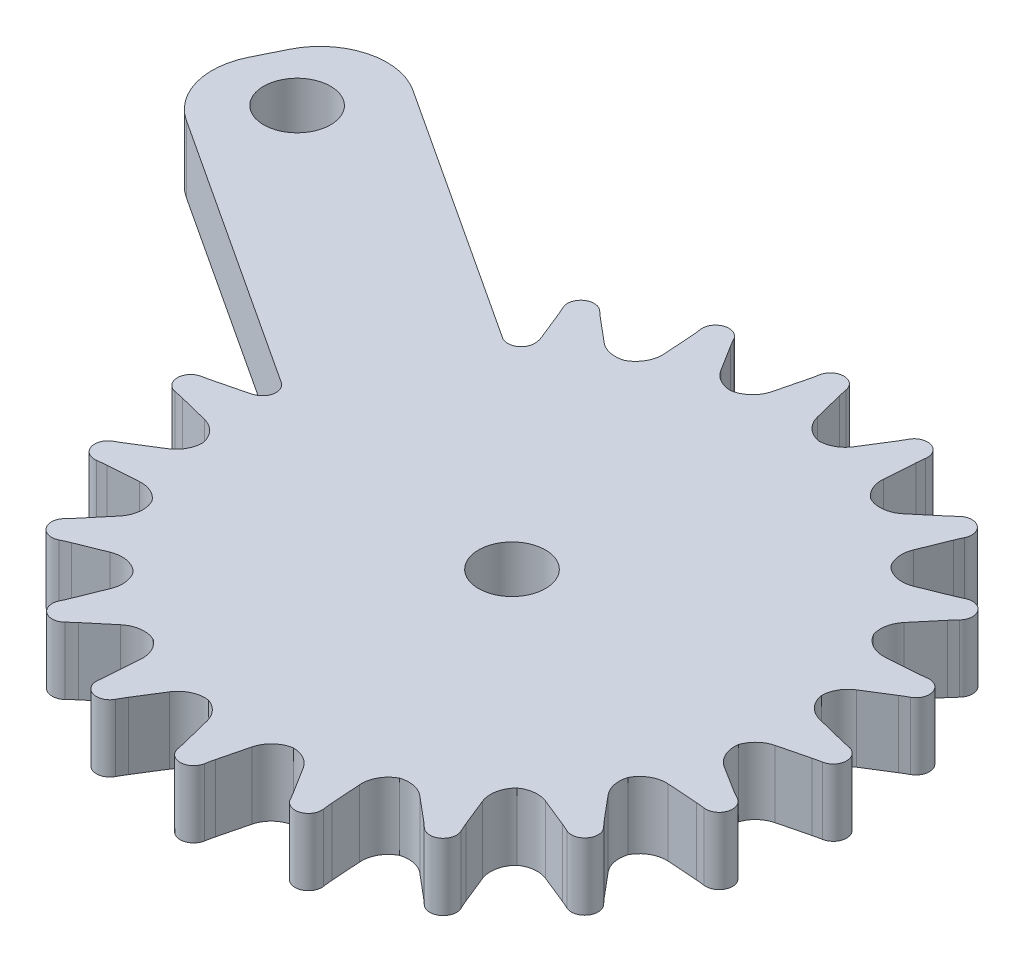
from build123d import *

# Parameters (mm, degrees)
SKETCH1_R           = 20
BOSS_EXTRUDE1_DEPTH = 5
BOSS_EXTRUDE2_START = -5
BOSS_EXTRUDE2_DEPTH = 5
FILLET1_R           = 2
CIRPATTERN1_DEPTH   = 5
SKETCH4_R           = 2.5
BOSS_EXTRUDE3_DEPTH = 5
FILLET2_R           = 5
SKETCH3_R           = 2.5
CUT_EXTRUDE1_DEPTH  = 10
SKETCH5_R           = 5
SKETCH5_R_2         = 2.5
BOSS_EXTRUDE4_DEPTH = 5
FILLET3_R           = 2
FILLET4_R           = 1


# Read off the part's stored shape, not the designer's step: CirPattern1
with BuildPart() as part:
    # Sketch1 → Boss-Extrude1 (new body)
    with BuildSketch(Plane(origin=(0, 0, 0), x_dir=(1, 0, 0), z_dir=(0, 1, 0))):
        with Locations(Location((0, 0, 0), (0, 0, 270))):
            Circle(SKETCH1_R)
    extrude(amount=BOSS_EXTRUDE1_DEPTH)

    # Sketch2 → Boss-Extrude2 (add)
    with BuildSketch(Plane(origin=(0, 5, 0), x_dir=(1, 0, 0), z_dir=(0, 1, 0)).offset(BOSS_EXTRUDE2_START)):
        with BuildLine():
            Line((-2.105791814, 19.888832063), (-1.238592318, 23.357630049))
            ThreePointArc((-1.238592318, 23.357630049), (-1.158488111, 23.704119695), (-1.090754777, 24.053238521))
            ThreePointArc((-1.090754777, 24.053238521), (-0.109023339, 24.880258639), (0.877972386, 24.059528275))
            ThreePointArc((0.877972386, 24.059528275), (0.941143779, 23.742067411), (1.014556469, 23.426817347))
            Line((1.014556469, 23.426817347), (1.893724984, 19.910143286))
            ThreePointArc((1.893724984, 19.910143286), (-0.106567477, 19.999716082), (-2.105791814, 19.888832063))
        make_face()
    extrude(amount=BOSS_EXTRUDE2_DEPTH)

    # Fillet1
    fillet1_edges = [part.edges().sort_by_distance(p)[0] for p in [
        (1.893724984, 2.5, -19.910143286),
        (-2.105791814, 2.5, -19.888832063),
    ]]
    fillet(fillet1_edges, radius=FILLET1_R)

    # CirPattern1 outline → CirPattern1 (add)
    with BuildSketch(Plane(origin=(0, 0, 0), x_dir=(1, 0, 0), z_dir=(0, 1, 0))):
        with BuildLine():
            ThreePointArc((-18.818349161, -15.020578024), (-18.496093443, -14.870168545), (-18.16869336, -14.731312705))
            Line((-18.16869336, -14.731312705), (-16.10451314, -13.898848252))
            ThreePointArc((-16.10451314, -13.898848252), (-14.969635701, -13.791456908), (-13.960430105, -14.321535926))
            ThreePointArc((-13.960430105, -14.321535926), (-16.121714854, -11.835975249), (-17.845731798, -9.029388491))
            ThreePointArc((-17.845731798, -9.029388491), (-17.643410931, -10.160914391), (-18.097403186, -11.216933153))
            Line((-18.097403186, -11.216933153), (-19.549034688, -12.94914432))
            ThreePointArc((-19.549034688, -12.94914432), (-19.760926451, -13.193835771), (-19.980626471, -13.431541317))
            ThreePointArc((-19.980626471, -13.431541317), (-20.064469753, -14.712450836), (-18.818349161, -15.020578024))
        make_face()
        with BuildLine():
            ThreePointArc((-8.242021953, 19.611282475), (-8.490583131, 18.498764143), (-9.306579914, 17.702756009))
            ThreePointArc((-9.306579914, 17.702756009), (-6.422679306, 18.940675556), (-3.380631018, 19.712212811))
            ThreePointArc((-3.380631018, 19.712212811), (-4.340011374, 19.966775936), (-5.058856916, 20.651227642))
            Line((-5.058856916, 20.651227642), (-6.274384144, 22.593742485))
            ThreePointArc((-6.274384144, 22.593742485), (-6.441621387, 22.870877344), (-6.599801755, 23.153279533))
            ThreePointArc((-6.599801755, 23.153279533), (-7.792110102, 23.628842042), (-8.470228911, 22.53892747))
            ThreePointArc((-8.470228911, 22.53892747), (-8.42676349, 22.185964985), (-8.395875928, 21.831680188))
            Line((-8.395875928, 21.831680188), (-8.242021953, 19.611282475))
        make_face()
        with BuildLine():
            ThreePointArc((-13.898848252, 16.10451314), (-13.791456908, 14.969635701), (-14.321535926, 13.960430105))
            ThreePointArc((-14.321535926, 13.960430105), (-11.961321637, 16.028935855), (-9.306579913, 17.702756008))
            ThreePointArc((-9.306579913, 17.702756008), (-10.297669185, 17.648395093), (-11.192839131, 18.077211859))
            Line((-11.192839131, 18.077211859), (-12.94914432, 19.549034688))
            ThreePointArc((-12.94914432, 19.549034688), (-13.193835771, 19.760926451), (-13.431541317, 19.980626471))
            ThreePointArc((-13.431541317, 19.980626471), (-14.712450836, 20.064469753), (-15.020578024, 18.818349161))
            ThreePointArc((-15.020578024, 18.818349161), (-14.870168545, 18.496093443), (-14.731312705, 18.16869336))
            Line((-14.731312705, 18.16869336), (-13.898848252, 16.10451314))
        make_face()
        with BuildLine():
            ThreePointArc((-18.195158445, 11.021321851), (-17.742326793, 9.975175019), (-17.934600217, 8.851560036))
            ThreePointArc((-17.934600217, 8.851560036), (-16.329106467, 11.548172233), (-14.321535925, 13.960430104))
            ThreePointArc((-14.321535925, 13.960430104), (-15.247319388, 13.602466375), (-16.231188267, 13.733672628))
            Line((-16.231188267, 13.733672628), (-18.356352028, 14.59073117))
            ThreePointArc((-18.356352028, 14.59073117), (-18.654545583, 14.716638395), (-18.948508031, 14.852130478))
            ThreePointArc((-18.948508031, 14.852130478), (-20.192634375, 14.536047367), (-20.100608305, 13.255699721))
            ThreePointArc((-20.100608305, 13.255699721), (-19.857977897, 12.995695406), (-19.624745956, 12.727228237))
            Line((-19.624745956, 12.727228237), (-18.195158445, 11.021321851))
        make_face()
        with BuildLine():
            ThreePointArc((-20.710399757, 4.85928679), (-19.956454114, 4.004274704), (-19.792100881, 2.876237597))
            ThreePointArc((-19.792100881, 2.876237597), (-19.098484585, 5.936993052), (-17.934600215, 8.851560035))
            ThreePointArc((-17.934600215, 8.851560035), (-18.704455735, 8.225033474), (-19.680715605, 8.045785833))
            Line((-19.680715605, 8.045785833), (-21.966712103, 8.204185225))
            ThreePointArc((-21.966712103, 8.204185225), (-22.289218499, 8.231783236), (-22.610662757, 8.269804472))
            ThreePointArc((-22.610662757, 8.269804472), (-23.696222171, 7.584735387), (-23.213050996, 6.395490034))
            ThreePointArc((-23.213050996, 6.395490034), (-22.901950013, 6.223188155), (-22.597172338, 6.039933339))
            Line((-22.597172338, 6.039933339), (-20.710399757, 4.85928679))
        make_face()
        with BuildLine():
            ThreePointArc((-21.198362842, -1.778409119), (-20.217104661, -2.358591919), (-19.712212811, -3.380631018))
            ThreePointArc((-19.712212811, -3.380631018), (-19.998369964, -0.255340374), (-19.792100879, 2.876237597))
            ThreePointArc((-19.792100879, 2.876237597), (-20.330669633, 2.042476989), (-21.203757377, 1.570321461))
            Line((-21.203757377, 1.570321461), (-23.426817347, 1.014556469))
            ThreePointArc((-23.426817347, 1.014556469), (-23.74206741, 0.941143779), (-24.059528275, 0.877972386))
            ThreePointArc((-24.059528275, 0.877972386), (-24.880258639, -0.109023339), (-24.053238521, -1.090754777))
            ThreePointArc((-24.053238521, -1.090754777), (-23.704119695, -1.158488111), (-23.357630049, -1.238592318))
            Line((-23.357630049, -1.238592318), (-21.198362842, -1.778409119))
        make_face()
        with BuildLine():
            ThreePointArc((-19.579720151, -8.239834962), (-18.612665626, -8.414862877), (-17.845731799, -9.029388492))
            ThreePointArc((-17.845731799, -9.029388492), (-18.990179463, -6.274797518), (-19.71221281, -3.380631018))
            ThreePointArc((-19.71221281, -3.380631018), (-19.966775936, -4.340011374), (-20.651227642, -5.058856916))
            Line((-20.651227642, -5.058856916), (-22.593742485, -6.274384144))
            ThreePointArc((-22.593742485, -6.274384144), (-22.870877344, -6.441621387), (-23.153279533, -6.599801755))
            ThreePointArc((-23.153279533, -6.599801755), (-23.628842042, -7.792110102), (-22.53892747, -8.470228911))
            ThreePointArc((-22.53892747, -8.470228911), (-22.185964985, -8.42676349), (-21.831680188, -8.395875928))
            Line((-21.831680188, -8.395875928), (-19.579720151, -8.239834962))
        make_face()
        with BuildLine():
            ThreePointArc((3.184529229, 19.744841696), (6.085729599, 19.051611356), (8.851560036, 17.934600217))
            ThreePointArc((8.851560036, 17.934600217), (8.225033474, 18.704455735), (8.045785833, 19.680715605))
            Line((8.045785833, 19.680715605), (8.204185225, 21.966712103))
            ThreePointArc((8.204185225, 21.966712103), (8.231783236, 22.289218499), (8.269804472, 22.610662757))
            ThreePointArc((8.269804472, 22.610662757), (7.584735387, 23.696222171), (6.395490034, 23.213050996))
            ThreePointArc((6.395490034, 23.213050996), (6.223188155, 22.901950013), (6.039933339, 22.597172338))
            Line((6.039933339, 22.597172338), (4.842504233, 20.683579819))
            ThreePointArc((4.842504233, 20.683579819), (4.132483288, 20.004095101), (3.184529229, 19.744841696))
        make_face()
        with BuildLine():
            ThreePointArc((8.851560036, 17.934600217), (11.548172234, 16.329106469), (13.960430106, 14.321535927))
            ThreePointArc((13.960430106, 14.321535927), (13.602466375, 15.247319388), (13.733672628, 16.231188267))
            Line((13.733672628, 16.231188267), (14.59073117, 18.356352028))
            ThreePointArc((14.59073117, 18.356352028), (14.716638395, 18.654545583), (14.852130478, 18.948508031))
            ThreePointArc((14.852130478, 18.948508031), (14.536047367, 20.192634375), (13.255699721, 20.100608305))
            ThreePointArc((13.255699721, 20.100608305), (12.995695406, 19.857977897), (12.727228237, 19.624745956))
            Line((12.727228237, 19.624745956), (11.021321851, 18.195158445))
            ThreePointArc((11.021321851, 18.195158445), (9.975175019, 17.742326793), (8.851560036, 17.934600217))
        make_face()
        with BuildLine():
            ThreePointArc((13.960430106, 14.321535927), (16.028935857, 11.961321639), (17.70275601, 9.306579915))
            ThreePointArc((17.70275601, 9.306579915), (17.648395093, 10.297669185), (18.077211859, 11.192839131))
            Line((18.077211859, 11.192839131), (19.549034688, 12.94914432))
            ThreePointArc((19.549034688, 12.94914432), (19.760926451, 13.193835771), (19.980626471, 13.431541317))
            ThreePointArc((19.980626471, 13.431541317), (20.064469753, 14.712450836), (18.818349161, 15.020578024))
            ThreePointArc((18.818349161, 15.020578024), (18.496093443, 14.870168545), (18.16869336, 14.731312705))
            Line((18.16869336, 14.731312705), (16.10451314, 13.898848252))
            ThreePointArc((16.10451314, 13.898848252), (14.969635701, 13.791456908), (13.960430106, 14.321535927))
        make_face()
        with BuildLine():
            ThreePointArc((17.70275601, 9.306579915), (18.940675558, 6.422679307), (19.712212813, 3.380631018))
            ThreePointArc((19.712212813, 3.380631018), (19.966775936, 4.340011374), (20.651227642, 5.058856916))
            Line((20.651227642, 5.058856916), (22.593742485, 6.274384144))
            ThreePointArc((22.593742485, 6.274384144), (22.870877344, 6.441621387), (23.153279533, 6.599801755))
            ThreePointArc((23.153279533, 6.599801755), (23.628842042, 7.792110102), (22.53892747, 8.470228911))
            ThreePointArc((22.53892747, 8.470228911), (22.185964985, 8.42676349), (21.831680188, 8.395875928))
            Line((21.831680188, 8.395875928), (19.611282475, 8.242021953))
            ThreePointArc((19.611282475, 8.242021953), (18.498764143, 8.490583131), (17.70275601, 9.306579915))
        make_face()
        with BuildLine():
            ThreePointArc((19.712212813, 3.380631018), (19.998369968, 0.255340374), (19.792100883, -2.876237597))
            ThreePointArc((19.792100883, -2.876237597), (20.330669633, -2.042476989), (21.203757377, -1.570321461))
            Line((21.203757377, -1.570321461), (23.426817347, -1.014556469))
            ThreePointArc((23.426817347, -1.014556469), (23.74206741, -0.941143779), (24.059528275, -0.877972386))
            ThreePointArc((24.059528275, -0.877972386), (24.880258639, 0.109023339), (24.053238521, 1.090754777))
            ThreePointArc((24.053238521, 1.090754777), (23.704119695, 1.158488111), (23.357630049, 1.238592318))
            Line((23.357630049, 1.238592318), (21.198362842, 1.778409119))
            ThreePointArc((21.198362842, 1.778409119), (20.217104661, 2.358591919), (19.712212813, 3.380631018))
        make_face()
        with BuildLine():
            ThreePointArc((19.792100883, -2.876237597), (19.051611357, -6.085729599), (17.794386708, -9.130158911))
            ThreePointArc((17.794386708, -9.130158911), (18.590889166, -8.301383653), (19.712076244, -8.047958848))
            Line((19.712076244, -8.047958848), (21.966712103, -8.204185225))
            ThreePointArc((21.966712103, -8.204185225), (22.289218499, -8.231783236), (22.610662757, -8.269804472))
            ThreePointArc((22.610662757, -8.269804472), (23.696222171, -7.584735387), (23.213050996, -6.395490034))
            ThreePointArc((23.213050996, -6.395490034), (22.901950013, -6.223188155), (22.597172338, -6.039933339))
            Line((22.597172338, -6.039933339), (20.710399757, -4.85928679))
            ThreePointArc((20.710399757, -4.85928679), (19.956454114, -4.004274704), (19.792100883, -2.876237597))
        make_face()
        with BuildLine():
            ThreePointArc((17.794386708, -9.130158911), (16.238565258, -11.675144471), (14.321535927, -13.960430106))
            ThreePointArc((14.321535927, -13.960430106), (15.247319388, -13.602466375), (16.231188267, -13.733672628))
            Line((16.231188267, -13.733672628), (18.356352028, -14.59073117))
            ThreePointArc((18.356352028, -14.59073117), (18.654545583, -14.716638395), (18.948508031, -14.852130478))
            ThreePointArc((18.948508031, -14.852130478), (20.192634375, -14.536047367), (20.100608305, -13.255699721))
            ThreePointArc((20.100608305, -13.255699721), (19.857977897, -12.995695406), (19.624745956, -12.727228237))
            Line((19.624745956, -12.727228237), (18.174837264, -10.997072875))
            ThreePointArc((18.174837264, -10.997072875), (17.748017433, -10.111830503), (17.794386708, -9.130158911))
        make_face()
        with BuildLine():
            ThreePointArc((14.321535927, -13.960430106), (11.961321639, -16.028935857), (9.306579914, -17.70275601))
            ThreePointArc((9.306579914, -17.70275601), (10.297669185, -17.648395093), (11.192839131, -18.077211859))
            Line((11.192839131, -18.077211859), (12.94914432, -19.549034688))
            ThreePointArc((12.94914432, -19.549034688), (13.193835771, -19.760926451), (13.431541317, -19.980626471))
            ThreePointArc((13.431541317, -19.980626471), (14.712450836, -20.064469753), (15.020578024, -18.818349161))
            ThreePointArc((15.020578024, -18.818349161), (14.870168545, -18.496093443), (14.731312705, -18.16869336))
            Line((14.731312705, -18.16869336), (13.898848252, -16.10451314))
            ThreePointArc((13.898848252, -16.10451314), (13.791456908, -14.969635701), (14.321535927, -13.960430106))
        make_face()
        with BuildLine():
            ThreePointArc((9.306579914, -17.70275601), (6.422679306, -18.940675557), (3.380631018, -19.712212812))
            ThreePointArc((3.380631018, -19.712212812), (4.340011374, -19.966775936), (5.058856916, -20.651227642))
            Line((5.058856916, -20.651227642), (6.274384144, -22.593742485))
            ThreePointArc((6.274384144, -22.593742485), (6.441621387, -22.870877344), (6.599801755, -23.153279533))
            ThreePointArc((6.599801755, -23.153279533), (7.792110102, -23.628842042), (8.470228911, -22.53892747))
            ThreePointArc((8.470228911, -22.53892747), (8.42676349, -22.185964985), (8.395875928, -21.831680188))
            Line((8.395875928, -21.831680188), (8.242021953, -19.611282475))
            ThreePointArc((8.242021953, -19.611282475), (8.490583131, -18.498764143), (9.306579914, -17.70275601))
        make_face()
        with BuildLine():
            ThreePointArc((3.380631018, -19.712212812), (0.255340374, -19.998369966), (-2.876237597, -19.792100881))
            ThreePointArc((-2.876237597, -19.792100881), (-2.042476989, -20.330669633), (-1.570321461, -21.203757377))
            Line((-1.570321461, -21.203757377), (-1.014556469, -23.426817347))
            ThreePointArc((-1.014556469, -23.426817347), (-0.941143779, -23.74206741), (-0.877972386, -24.059528275))
            ThreePointArc((-0.877972386, -24.059528275), (0.109023339, -24.880258639), (1.090754777, -24.053238521))
            ThreePointArc((1.090754777, -24.053238521), (1.158488111, -23.704119695), (1.238592318, -23.357630049))
            Line((1.238592318, -23.357630049), (1.778409119, -21.198362842))
            ThreePointArc((1.778409119, -21.198362842), (2.358591919, -20.217104661), (3.380631018, -19.712212812))
        make_face()
        with BuildLine():
            ThreePointArc((-2.876237597, -19.792100881), (-5.936993053, -19.098484586), (-8.851560035, -17.934600216))
            ThreePointArc((-8.851560035, -17.934600216), (-8.225033474, -18.704455735), (-8.045785833, -19.680715605))
            Line((-8.045785833, -19.680715605), (-8.204185225, -21.966712103))
            ThreePointArc((-8.204185225, -21.966712103), (-8.231783236, -22.289218499), (-8.269804472, -22.610662757))
            ThreePointArc((-8.269804472, -22.610662757), (-7.584735387, -23.696222171), (-6.395490034, -23.213050996))
            ThreePointArc((-6.395490034, -23.213050996), (-6.223188155, -22.901950013), (-6.039933339, -22.597172338))
            Line((-6.039933339, -22.597172338), (-4.85928679, -20.710399757))
            ThreePointArc((-4.85928679, -20.710399757), (-4.004274704, -19.956454114), (-2.876237597, -19.792100881))
        make_face()
        with BuildLine():
            ThreePointArc((-8.851560035, -17.934600216), (-11.548172233, -16.329106468), (-13.960430104, -14.321535925))
            ThreePointArc((-13.960430104, -14.321535925), (-13.602466375, -15.247319388), (-13.733672628, -16.231188267))
            Line((-13.733672628, -16.231188267), (-14.59073117, -18.356352028))
            ThreePointArc((-14.59073117, -18.356352028), (-14.716638395, -18.654545583), (-14.852130478, -18.948508031))
            ThreePointArc((-14.852130478, -18.948508031), (-14.536047367, -20.192634375), (-13.255699721, -20.100608305))
            ThreePointArc((-13.255699721, -20.100608305), (-12.995695406, -19.857977897), (-12.727228237, -19.624745956))
            Line((-12.727228237, -19.624745956), (-11.021321851, -18.195158445))
            ThreePointArc((-11.021321851, -18.195158445), (-9.975175019, -17.742326793), (-8.851560035, -17.934600216))
        make_face()
    extrude(amount=CIRPATTERN1_DEPTH)

    # Sketch4 → Boss-Extrude3 (add)
    with BuildSketch(Plane.XZ):
        Polygon((-19.792100881, -2.876237597), (-44.897063424, -19.30002692), (-39.426498468, -30.384219429), (-14.321535926, -13.960430105), align=None)
        with Locations(Location((-38.007180457, -21.962528948, 0), (0, 0, 270))):
            Circle(SKETCH4_R, mode=Mode.SUBTRACT)
    extrude(amount=-BOSS_EXTRUDE3_DEPTH)

    # Fillet2
    fillet2_edges = [part.edges().sort_by_distance(p)[0] for p in [
        (-39.426498468, 2.5, -30.384219429),
        (-44.897063424, 2.5, -19.30002692),
    ]]
    fillet(fillet2_edges, radius=FILLET2_R)

    # Sketch3 → Cut-Extrude1 (cut)
    with BuildSketch(Plane(origin=(0, 5, 0), x_dir=(1, 0, 0), z_dir=(0, 1, 0))):
        with Locations(Location((0, 0, 0), (0, 0, 270))):
            Circle(SKETCH3_R)
    extrude(amount=-CUT_EXTRUDE1_DEPTH, mode=Mode.SUBTRACT)

    # Sketch5 → Boss-Extrude4 (add)
    with BuildSketch(Plane.XZ):
        with Locations(Location((0, 0, 0), (0, 0, 90))):
            Circle(SKETCH5_R)
        with Locations(Location((0, 0, 0), (0, 0, 90))):
            Circle(SKETCH5_R_2, mode=Mode.SUBTRACT)
    extrude(amount=BOSS_EXTRUDE4_DEPTH)

    # Fillet3
    fillet3_edges = [part.edges().sort_by_distance(p)[0] for p in [
        (0, 0, -5),
    ]]
    fillet(fillet3_edges, radius=FILLET3_R)

    # Fillet4
    fillet4_edges = [part.edges().sort_by_distance(p)[0] for p in [
        (-14.321535926, 2.5, -13.960430105),
        (-19.792100881, 2.5, -2.876237597),
    ]]
    fillet(fillet4_edges, radius=FILLET4_R)


solid = part.part
